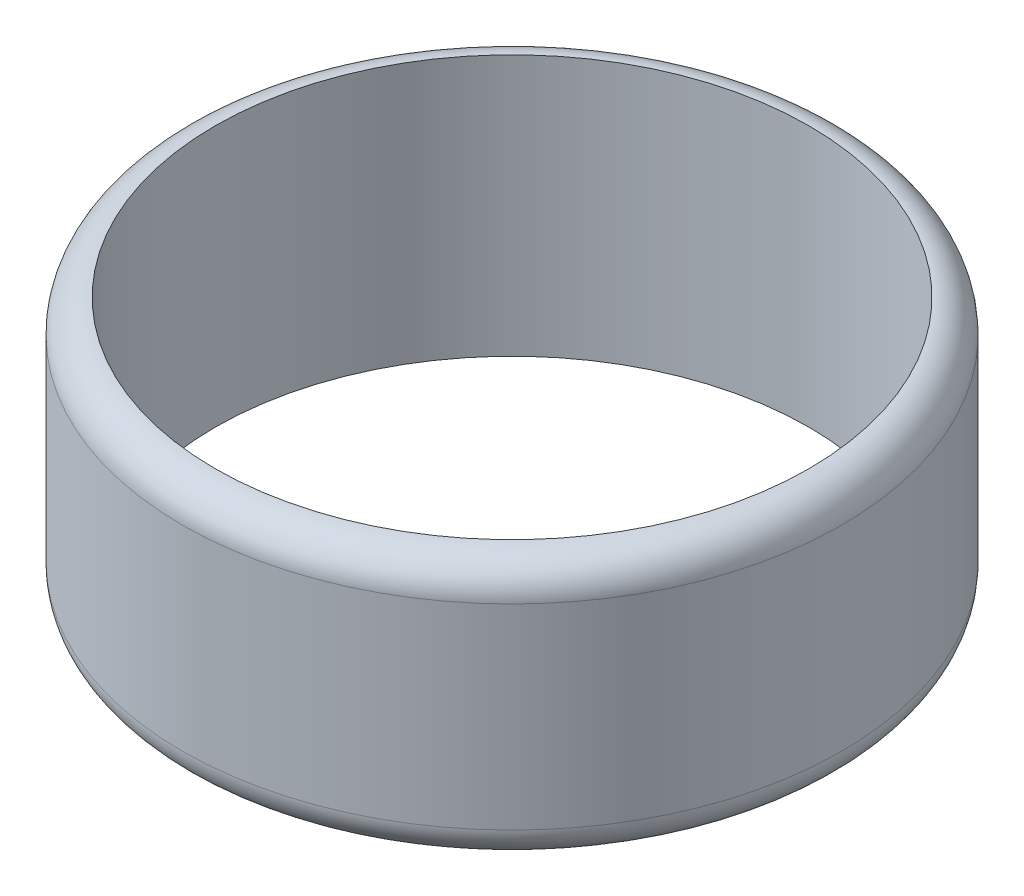
from build123d import *

# Parameters (mm, degrees)
SKETCH1_R            = 50.5
SKETCH1_R_2          = 45
SKETCH1_R_3          = 40
BOSS_EXTRUDE1_DEPTH  = 40
FILLET1_R            = 5
FILLET2_R            = 5
CUT_EXTRUDE1_START   = -0.5
SKETCH2_R            = 41.5
SKETCH2_R_2          = 40
CUT_EXTRUDE1_DEPTH   = 0.5
SKETCH3_R            = 1
BOSS_EXTRUDE2_DEPTH  = 5
SKETCH4_R            = 12
BOSS_EXTRUDE3_DEPTH  = 7.5
CUT_EXTRUDE2_DEPTH   = 5
SKETCH6_R            = 6
CUT_EXTRUDE3_DEPTH   = 79.259184829
BOSS_EXTRUDE10_START = -12.5
BOSS_EXTRUDE10_DEPTH = 12.5
CIRPATTERN2_START    = 27
CIRPATTERN2_DEPTH    = 12.5
SKETCH8_R            = 45.5
CUT_EXTRUDE4_DEPTH   = 82.85658196


# Read off the part's stored shape, not the designer's step: Boss-Extrude10, CirPattern2, Cut-Revolve1
with BuildPart() as part:
    # Sketch1 → Boss-Extrude1 (new body)
    # profile 1 of 2: a face of its own
    with BuildSketch(Plane(origin=(0, 0, 0), x_dir=(1, 0, 0), z_dir=(0, 1, 0))):
        with Locations(Location((0, 0, 0), (0, 0, 270))):
            Circle(SKETCH1_R)
        Circle(SKETCH1_R_2, mode=Mode.SUBTRACT)
    # profile 2 of 2: a face of its own
    with BuildSketch(Plane(origin=(0, 0, 0), x_dir=(1, 0, 0), z_dir=(0, 1, 0))):
        Circle(SKETCH1_R_2)
        with Locations(Location((0, 0, 0), (0, 0, 270))):
            Circle(SKETCH1_R_3, mode=Mode.SUBTRACT)
    extrude(amount=BOSS_EXTRUDE1_DEPTH)

    # Fillet1
    fillet1_edges = [part.edges().sort_by_distance(p)[0] for p in [
        (0, 40, -50.5),
    ]]
    fillet(fillet1_edges, radius=FILLET1_R)

    # Fillet2
    fillet2_edges = [part.edges().sort_by_distance(p)[0] for p in [
        (0, 0, -50.5),
    ]]
    fillet(fillet2_edges, radius=FILLET2_R)

    # Sketch2 → Cut-Extrude1 (cut)
    with BuildSketch(Plane(origin=(0, 40, 0), x_dir=(1, 0, 0), z_dir=(0, 1, 0)).offset(CUT_EXTRUDE1_START)):
        with Locations(Location((0, 0, 0), (0, 0, 270))):
            Circle(SKETCH2_R)
        with Locations(Location((0, 0, 0), (0, 0, 270))):
            Circle(SKETCH2_R_2, mode=Mode.SUBTRACT)
    extrude(amount=CUT_EXTRUDE1_DEPTH, mode=Mode.SUBTRACT)


with BuildPart() as body_2:
    # Sketch3 → Boss-Extrude2 (new body)
    with BuildSketch(Plane(origin=(0, 39.5, 0), x_dir=(1, 0, 0), z_dir=(0, 1, 0))):
        with Locations(Location((0, 0, 0), (0, 0, 270))):
            Circle(SKETCH3_R)
    extrude(amount=-BOSS_EXTRUDE2_DEPTH)

    # Sketch4 → Boss-Extrude3 (add)
    with BuildSketch(Plane.XZ.offset(-34.5)):
        with Locations(Location((0, 0, 0), (0, 0, 270))):
            Circle(SKETCH4_R)
    extrude(amount=BOSS_EXTRUDE3_DEPTH)

    # Sketch5 → Cut-Extrude2 (cut)
    with BuildSketch(Plane.XZ.offset(-27)):
        Polygon((1.172923904, 10.937287119), (-8.885506541, 6.484425457), (-10.058430445, -4.452861662), (-1.172923904, -10.937287119), (8.885506541, -6.484425457), (10.058430445, 4.452861662), align=None)
    extrude(amount=-CUT_EXTRUDE2_DEPTH, mode=Mode.SUBTRACT)

    # Sketch6 → Cut-Extrude3 (cut, through all)
    with BuildSketch(Plane.XZ.offset(-32)):
        with Locations(Location((0, 0, 0), (0, 0, 270))):
            Circle(SKETCH6_R)
    extrude(amount=-CUT_EXTRUDE3_DEPTH, mode=Mode.SUBTRACT)

    # Boss-Extrude10 outline → Boss-Extrude10 (add)
    with BuildSketch(Plane(origin=(0, 39.5, 0), x_dir=(1, 0, 0), z_dir=(0, 1, 0)).offset(BOSS_EXTRUDE10_START)):
        with BuildLine():
            ThreePointArc((-9.907874683, -6.770082663), (-10.682049717, -5.467523557), (-11.285904868, -4.077787551))
            ThreePointArc((-11.285904868, -4.077787551), (-11.291897259, -4.637537864), (-11.663342081, -5.056327867))
            Line((-11.663342081, -5.056327867), (-14.441281094, -6.530254709))
            ThreePointArc((-14.441281094, -6.530254709), (-15.188724822, -6.754494743), (-15.965085937, -6.675633223))
            Line((-15.965085937, -6.675633223), (-39.993984407, 0.693693915))
            ThreePointArc((-39.993984407, 0.693693915), (-39.913717484, -2.625863016), (-39.558397626, -5.927324632))
            ThreePointArc((-39.558397626, -5.927324632), (-38.549233859, -3.209595167), (-35.711897206, -2.614628217))
            Line((-35.711897206, -2.614628217), (-16.968675274, -8.362912276))
            ThreePointArc((-16.968675274, -8.362912276), (-16.496554918, -8.752791347), (-16.438401548, -9.362316987))
            Line((-16.438401548, -9.362316987), (-22.186706389, -28.105606681))
            ThreePointArc((-22.186706389, -28.105606681), (-24.270105502, -30.121529322), (-27.086328062, -29.433498469))
            ThreePointArc((-27.086328062, -29.433498469), (-25.333453103, -30.955066692), (-23.495271849, -32.372398749))
            Line((-23.495271849, -32.372398749), (-22.678682838, -32.949618279))
            Line((-22.678682838, -32.949618279), (-21.84791965, -33.506244298))
            Line((-21.84791965, -33.506244298), (-14.474389556, -9.463641401))
            ThreePointArc((-14.474389556, -9.463641401), (-14.104425603, -8.776547206), (-13.499682622, -8.283335601))
            Line((-13.499682622, -8.283335601), (-10.652684086, -6.77276696))
            ThreePointArc((-10.652684086, -6.77276696), (-10.280610826, -6.679459968), (-9.907874683, -6.770082663))
        make_face()
    extrude(amount=BOSS_EXTRUDE10_DEPTH)

    # CirPattern2 outline → CirPattern2 (add)
    with BuildSketch(Plane(origin=(0, 0, 0), x_dir=(1, 0, 0), z_dir=(0, 1, 0)).offset(CIRPATTERN2_START)):
        with BuildLine():
            ThreePointArc((-9.500432888, 7.330878183), (-8.500858804, 8.469675294), (-7.365742824, 9.473427714))
            ThreePointArc((-7.365742824, 9.473427714), (-7.899948758, 9.306154457), (-8.413024481, 9.530006248))
            Line((-8.413024481, 9.530006248), (-10.673242573, 11.716514805))
            ThreePointArc((-10.673242573, 11.716514805), (-11.117480333, 12.358082052), (-11.282387348, 13.120814899))
            Line((-11.282387348, 13.120814899), (-11.699078736, 38.250902692))
            ThreePointArc((-11.699078736, 38.250902692), (-14.831361144, 37.148764806), (-17.861437852, 35.790627793))
            ThreePointArc((-17.861437852, 35.790627793), (-14.964874781, 35.670680608), (-13.522242341, 33.156067994))
            Line((-13.522242341, 33.156067994), (-13.197211247, 13.553887176))
            ThreePointArc((-13.197211247, 13.553887176), (-13.422115065, 12.984394777), (-13.983838017, 12.740733854))
            Line((-13.983838017, 12.740733854), (-33.586089702, 12.415701585))
            ThreePointArc((-33.586089702, 12.415701585), (-36.147151798, 13.774177532), (-36.363056203, 16.665177575))
            ThreePointArc((-36.363056203, 16.665177575), (-37.268485425, 14.527903984), (-38.048419067, 12.341710032))
            Line((-38.048419067, 12.341710032), (-38.345047581, 11.386717087))
            Line((-38.345047581, 11.386717087), (-38.61771044, 10.424607444))
            Line((-38.61771044, 10.424607444), (-13.473290178, 10.841536484))
            ThreePointArc((-13.473290178, 10.841536484), (-12.705499618, 10.70200364), (-12.049551649, 10.279269655))
            Line((-12.049551649, 10.279269655), (-9.733144569, 8.038404527))
            ThreePointArc((-9.733144569, 8.038404527), (-9.529427386, 7.713375274), (-9.500432888, 7.330878183))
        make_face()
        with BuildLine():
            ThreePointArc((4.03628425, 11.300814548), (5.428230042, 10.702070763), (6.73362545, 9.932687868))
            ThreePointArc((6.73362545, 9.932687868), (6.409460418, 10.389057624), (6.463807004, 10.946195641))
            Line((6.463807004, 10.946195641), (7.844854414, 13.771459088))
            ThreePointArc((7.844854414, 13.771459088), (8.317744107, 14.392209487), (8.992187082, 14.784742791))
            Line((8.992187082, 14.784742791), (32.763556111, 22.946664049))
            ThreePointArc((32.763556111, 22.946664049), (30.747432198, 25.585062307), (28.519421945, 28.047149087))
            ThreePointArc((28.519421945, 28.047149087), (29.300432607, 25.255288185), (27.354691835, 23.106205171))
            Line((27.354691835, 23.106205171), (8.812350166, 16.739675231))
            ThreePointArc((8.812350166, 16.739675231), (8.201231607, 16.777588643), (7.795914361, 17.23652355))
            Line((7.795914361, 17.23652355), (1.429361404, 35.778932255))
            ThreePointArc((1.429361404, 35.778932255), (1.929937095, 38.634439204), (4.612723394, 39.733144639))
            ThreePointArc((4.612723394, 39.733144639), (2.300262401, 39.933805139), (-0.019944352, 39.999995028))
            Line((-0.019944352, 39.999995028), (-1.019859867, 39.986996459))
            Line((-1.019859867, 39.986996459), (-2.01913797, 39.949006018))
            Line((-2.01913797, 39.949006018), (6.147438285, 16.164079439))
            ThreePointArc((6.147438285, 16.164079439), (6.251994995, 15.390749203), (6.052650154, 14.636273627))
            Line((6.052650154, 14.636273627), (4.637269925, 11.740774173))
            ThreePointArc((4.637269925, 11.740774173), (4.391100809, 11.446588055), (4.03628425, 11.300814548))
        make_face()
        with BuildLine():
            ThreePointArc((11.994993743, -0.346590692), (11.855689469, -1.855431813), (11.52735222, -3.334689012))
            ThreePointArc((11.52735222, -3.334689012), (11.861213145, -2.885363735), (12.407876906, -2.764885294))
            Line((12.407876906, -2.764885294), (15.521629237, -3.205285014))
            ThreePointArc((15.521629237, -3.205285014), (16.258128901, -3.463207416), (16.839864598, -3.98334134))
            Line((16.839864598, -3.98334134), (31.948070005, -24.069084381))
            ThreePointArc((31.948070005, -24.069084381), (33.834319309, -21.336326696), (35.487409954, -18.45653637))
            ThreePointArc((35.487409954, -18.45653637), (33.073538017, -20.062054114), (30.428371647, -18.875647848))
            Line((30.428371647, -18.875647848), (18.643543171, -3.208198923))
            ThreePointArc((18.643543171, -3.208198923), (18.490754948, -2.615274747), (18.801978065, -2.087976452))
            Line((18.801978065, -2.087976452), (34.469483632, 9.69689463))
            ThreePointArc((34.469483632, 9.69689463), (37.339918519, 10.103219032), (39.213876041, 7.891256292))
            ThreePointArc((39.213876041, 7.891256292), (38.690125771, 10.152544892), (38.036092779, 12.379646445))
            Line((38.036092779, 12.379646445), (37.714739519, 13.326605833))
            Line((37.714739519, 13.326605833), (37.369814547, 14.265236092))
            Line((37.369814547, 14.265236092), (17.272615982, -0.851585994))
            ThreePointArc((17.272615982, -0.851585994), (16.569445022, -1.18999752), (15.790295166, -1.233555084))
            Line((15.790295166, -1.233555084), (12.599134998, -0.782207034))
            ThreePointArc((12.599134998, -0.782207034), (12.243276933, -0.638994801), (11.994993743, -0.346590692))
        make_face()
        with BuildLine():
            ThreePointArc((3.377029578, -11.515019376), (1.89898901, -11.848790687), (0.390670022, -11.99363902))
            ThreePointArc((0.390670022, -11.99363902), (0.921172454, -12.172310482), (1.204682652, -12.654988728))
            Line((1.204682652, -12.654988728), (1.748040016, -15.75243417))
            ThreePointArc((1.748040016, -15.75243417), (1.730332147, -16.53258938), (1.415421606, -17.246583128))
            Line((1.415421606, -17.246583128), (-13.018562973, -37.822176274))
            ThreePointArc((-13.018562973, -37.822176274), (-9.836672879, -38.7716374), (-6.586996421, -39.453915879))
            ThreePointArc((-6.586996421, -39.453915879), (-8.859861984, -37.654319512), (-8.548923935, -34.7719971))
            Line((-8.548923935, -34.7719971), (2.709993184, -18.722451208))
            ThreePointArc((2.709993184, -18.722451208), (3.226683428, -18.393917326), (3.824347139, -18.526963966))
            Line((3.824347139, -18.526963966), (19.873951055, -29.785921788))
            ThreePointArc((19.873951055, -29.785921788), (21.147401687, -32.390306446), (19.62278483, -34.856080037))
            ThreePointArc((19.62278483, -34.856080037), (21.611550355, -33.659187323), (23.527542489, -32.348952756))
            Line((23.527542489, -32.348952756), (24.328850767, -31.7507011))
            Line((24.328850767, -31.7507011), (25.114953513, -31.132605256))
            Line((25.114953513, -31.132605256), (4.527625467, -16.690388528))
            ThreePointArc((4.527625467, -16.690388528), (3.988485204, -16.126208116), (3.706288951, -15.398652596))
            Line((3.706288951, -15.398652596), (3.149423732, -12.224204706))
            ThreePointArc((3.149423732, -12.224204706), (3.17566047, -11.841508561), (3.377029578, -11.515019376))
        make_face()
    extrude(amount=CIRPATTERN2_DEPTH)

    # Cut-Revolve1 outline → Cut-Revolve1 (revolve, cut)
    with BuildSketch(Plane.XY):
        with BuildLine():
            Line((12, 39.5), (12, 34.5))
            add(Edge.make_bspline(
                [(12, 34.5), (18.404764838, 39.5), (40, 39.5)],
                knots=[0, 0, 0, 1, 1, 1], degree=2))
            Line((40, 39.5), (12, 39.5))
        make_face()
    revolve(axis=Axis((0, 0, 0), (0, 1, 0)), mode=Mode.SUBTRACT)


with BuildPart() as cut_extrude4_tool:
    # Sketch8 → Cut-Extrude4 (new, through all)
    with BuildSketch(Plane(origin=(0, 40, 0), x_dir=(1, 0, 0), z_dir=(0, 1, 0))):
        with Locations(Location((0, 0, 0), (0, 0, 270))):
            Circle(SKETCH8_R)
    extrude(amount=-CUT_EXTRUDE4_DEPTH)


with BuildPart() as part_1:
    add(part.part)

    # Cut-Extrude4: cut by cut_extrude4_tool
    add(cut_extrude4_tool.part, mode=Mode.SUBTRACT)


with BuildPart() as body_2_1:
    add(body_2.part)

    # Cut-Extrude4: cut by cut_extrude4_tool
    add(cut_extrude4_tool.part, mode=Mode.SUBTRACT)


solid = part_1.part
